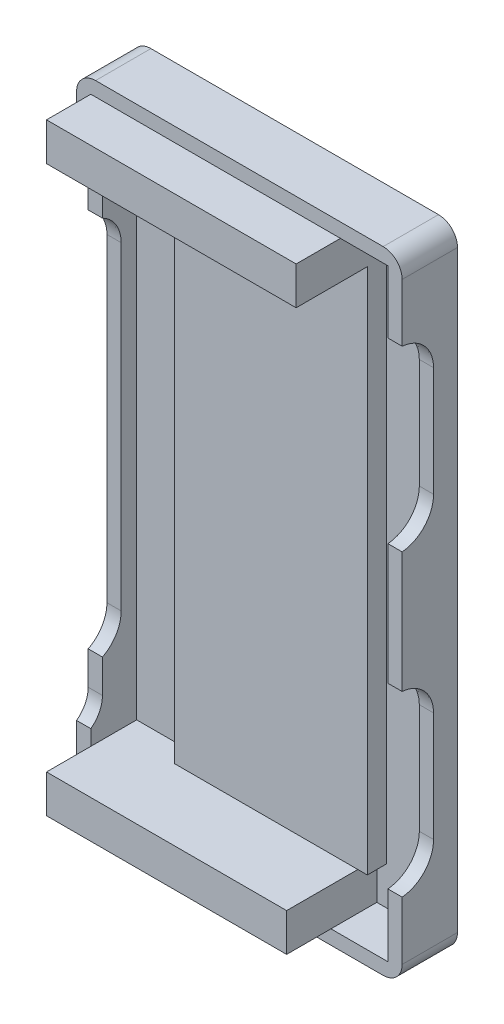
from build123d import *

# Parameters (mm, degrees)
BOSS_EXTRUDE3_DEPTH      = 3.249999
BOSS_EXTRUDE3_DEPTH_BACK = 16.581442
SKETCH1_W                = 34.3
SKETCH1_H                = 66.5
CUT_EXTRUDE1_DEPTH       = 5
CUT_EXTRUDE2_DEPTH       = 5
FILLET1_R                = 2
SKETCH5_W                = 51.30778099
SKETCH5_H                = 76.39990746
CUT_EXTRUDE3_DEPTH       = 14
SKETCH6_W                = 31.3
SKETCH6_H                = 63.5
CUT_EXTRUDE4_DEPTH       = 4.831437303
SKETCH7_W                = 26.3
SKETCH7_H                = 4
SKETCH7_W_2              = 25.3
BOSS_EXTRUDE4_DEPTH      = 9.5
SKETCH8_W                = 20.3
SKETCH8_H                = 55.5
BOSS_EXTRUDE5_DEPTH      = 2
CUT_EXTRUDE5_DEPTH       = 1.5


with BuildPart() as part:
    # Sketch1 → Boss-Extrude3 (new, two sides: drawn at the far end of the back side and taken through both)
    with BuildSketch(Plane.XY.offset(-BOSS_EXTRUDE3_DEPTH_BACK)):
        with Locations((-15.15, 31.25)):
            Rectangle(SKETCH1_W, SKETCH1_H)
    extrude(amount=BOSS_EXTRUDE3_DEPTH + BOSS_EXTRUDE3_DEPTH_BACK)

    # Sketch3 → Cut-Extrude1 (cut)
    with BuildSketch(Plane.ZY.offset(32.3)):
        with BuildLine():
            Line((-13.946442816, 47.860002379), (-13.946442816, 14.260002379))
            add(Edge.make_bspline(
                [(-13.946442816, 14.260002379), (-13.946442816, 14.019317473), (-13.90167089, 13.549905983), (-13.594210712, 12.544215416), (-12.741245974, 11.38215204), (-11.448721179, 10.74393594), (-10.404919412, 10.615783107), (-9.934864774, 10.653203818), (-9.697836412, 10.694998313)],
                knots=[0, 0, 0, 0, 0.125, 0.25, 0.5, 0.75, 0.875, 1, 1, 1, 1], degree=3))
            Line((-9.697836412, 10.694998313), (-6.707836413, 11.222215985))
            add(Edge.make_bspline(
                [(-6.707836413, 11.222215985), (-6.30796959, 11.292723295), (-5.54451734, 11.557407058), (-4.497780226, 12.405299319), (-3.844533346, 13.58336909), (-3.716442816, 14.381184638), (-3.716442816, 14.787220052)],
                knots=[0, 0, 0, 0, 0.25, 0.5, 0.75, 1, 1, 1, 1], degree=3))
            Line((-3.716442816, 14.787220052), (-3.716442816, 47.332784706))
            add(Edge.make_bspline(
                [(-3.716442816, 47.332784706), (-3.716442815, 47.73882012), (-3.844533346, 48.536635667), (-4.497780225, 49.714705439), (-5.544517339, 50.5625977), (-6.307969589, 50.827281463), (-6.707836412, 50.897788773)],
                knots=[0, 0, 0, 0, 0.25, 0.5, 0.75, 1, 1, 1, 1], degree=3))
            Line((-6.707836412, 50.897788773), (-9.697836412, 51.425006445))
            add(Edge.make_bspline(
                [(-9.697836412, 51.425006445), (-9.934864773, 51.46680094), (-10.404919411, 51.504221651), (-11.448721179, 51.376068818), (-12.741245974, 50.737852719), (-13.594210712, 49.575789343), (-13.90167089, 48.570098776), (-13.946442816, 48.100687285), (-13.946442816, 47.860002379)],
                knots=[0, 0, 0, 0, 0.125, 0.25, 0.5, 0.75, 0.875, 1, 1, 1, 1], degree=3))
        make_face()
    extrude(amount=-CUT_EXTRUDE1_DEPTH, mode=Mode.SUBTRACT)

    # Sketch4 → Cut-Extrude2 (cut)
    with BuildSketch(Plane(origin=(2, 0, 0), x_dir=(0, 0, -1), z_dir=(1, 0, 0))):
        with BuildLine():
            Line((6.817836087, 38.212213104), (9.807836086, 37.684995431))
            add(Edge.make_bspline(
                [(9.807836086, 37.684995431), (10.044864448, 37.643200936), (10.514919086, 37.605780225), (11.558720853, 37.733933058), (12.851245648, 38.372149158), (13.704210386, 39.534212534), (14.011670565, 40.539903101), (14.05644249, 41.009314591), (14.05644249, 41.249999497)],
                knots=[0, 0, 0, 0, 0.125, 0.25, 0.5, 0.75, 0.875, 1, 1, 1, 1], degree=3))
            Line((14.05644249, 41.249999497), (14.05644249, 52.799999497))
            add(Edge.make_bspline(
                [(14.05644249, 52.799999497), (14.05644249, 53.040684403), (14.011670565, 53.510095894), (13.704210386, 54.51578646), (12.851245648, 55.677849837), (11.558720853, 56.316065936), (10.514919086, 56.444218769), (10.044864448, 56.406798058), (9.807836087, 56.365003563)],
                knots=[0, 0, 0, 0, 0.125, 0.25, 0.5, 0.75, 0.875, 1, 1, 1, 1], degree=3))
            Line((9.807836087, 56.365003563), (6.817836087, 55.837785891))
            add(Edge.make_bspline(
                [(6.817836087, 55.837785891), (6.417969263, 55.767278581), (5.654517014, 55.502594818), (4.6077799, 54.654702557), (3.95453302, 53.476632786), (3.82644249, 52.678817239), (3.82644249, 52.272781825)],
                knots=[0, 0, 0, 0, 0.25, 0.5, 0.75, 1, 1, 1, 1], degree=3))
            Line((3.82644249, 52.272781825), (3.82644249, 41.77721717))
            add(Edge.make_bspline(
                [(3.82644249, 41.77721717), (3.82644249, 41.371181756), (3.95453302, 40.573366208), (4.6077799, 39.395296437), (5.654517014, 38.547404177), (6.417969263, 38.282720413), (6.817836087, 38.212213104)],
                knots=[0, 0, 0, 0, 0.25, 0.5, 0.75, 1, 1, 1, 1], degree=3))
        make_face()
        with BuildLine():
            Line((3.82644249, 20.772783732), (3.82644249, 10.277219077))
            add(Edge.make_bspline(
                [(3.82644249, 10.277219077), (3.82644249, 9.871183663), (3.95453302, 9.073368116), (4.6077799, 7.895298345), (5.654517014, 7.047406084), (6.417969263, 6.782722321), (6.817836087, 6.712215011)],
                knots=[0, 0, 0, 0, 0.25, 0.5, 0.75, 1, 1, 1, 1], degree=3))
            Line((6.817836087, 6.712215011), (9.807836086, 6.184997339))
            add(Edge.make_bspline(
                [(9.807836086, 6.184997339), (10.044864448, 6.143202843), (10.514919086, 6.105782132), (11.558720853, 6.233934965), (12.851245648, 6.872151065), (13.704210386, 8.034214441), (14.011670565, 9.039905008), (14.05644249, 9.509316499), (14.05644249, 9.750001404)],
                knots=[0, 0, 0, 0, 0.125, 0.25, 0.5, 0.75, 0.875, 1, 1, 1, 1], degree=3))
            Line((14.05644249, 9.750001404), (14.05644249, 21.300001404))
            add(Edge.make_bspline(
                [(14.05644249, 21.300001404), (14.05644249, 21.54068631), (14.011670565, 22.010097801), (13.704210386, 23.015788368), (12.851245648, 24.177851744), (11.558720853, 24.816067843), (10.514919086, 24.944220677), (10.044864448, 24.906799966), (9.807836087, 24.86500547)],
                knots=[0, 0, 0, 0, 0.125, 0.25, 0.5, 0.75, 0.875, 1, 1, 1, 1], degree=3))
            Line((9.807836087, 24.86500547), (6.817836087, 24.337787798))
            add(Edge.make_bspline(
                [(6.817836087, 24.337787798), (6.417969263, 24.267280488), (5.654517014, 24.002596725), (4.6077799, 23.154704464), (3.95453302, 21.976634693), (3.82644249, 21.178819146), (3.82644249, 20.772783732)],
                knots=[0, 0, 0, 0, 0.25, 0.5, 0.75, 1, 1, 1, 1], degree=3))
        make_face()
    extrude(amount=-CUT_EXTRUDE2_DEPTH, mode=Mode.SUBTRACT)

    # Fillet1
    fillet1_edges = [part.edges().sort_by_distance(p)[0] for p in [
        (-32.3, -2, -6.6657215),
        (2, -2, -6.6657215),
        (2, 64.5, -6.6657215),
        (-32.3, 64.5, -6.6657215),
    ]]
    fillet(fillet1_edges, radius=FILLET1_R)

    # Sketch5 → Cut-Extrude3 (cut)
    with BuildSketch(Plane(origin=(0, 2.84e-07, 3.250003097), x_dir=(1, 0, 0), z_dir=(0, 8.742273400000003e-08, 0.9999999999999963))):
        with Locations((-12.815688561, 29.564706803)):
            Rectangle(SKETCH5_W, SKETCH5_H)
    extrude(amount=-CUT_EXTRUDE3_DEPTH, mode=Mode.SUBTRACT)


with BuildPart() as cut_extrude3_kept_piece:
    # of the separate pieces the step leaves, the one the design keeps (cut_extrude3_pieces_kept)
    add(part.part.solids().sort_by_distance((-30.3, 64.5, -16.581442))[0])

    # Sketch6 → Cut-Extrude4 (cut)
    with BuildSketch(Plane(origin=(0, -9.4e-07, -10.749996903), x_dir=(1, 0, 0), z_dir=(0, 8.742273399652584e-08, 0.9999999999999963))):
        with Locations((-15.15, 31.25000094)):
            Rectangle(SKETCH6_W, SKETCH6_H)
    extrude(amount=-CUT_EXTRUDE4_DEPTH, mode=Mode.SUBTRACT)


with BuildPart() as boss_extrude4_tool:
    # Sketch7 → Boss-Extrude4 (new body)
    with BuildSketch(Plane(origin=(1.362e-06, 0, -15.581439757), x_dir=(0.9999999999999963, 0, 8.742273400000003e-08), z_dir=(-8.742273400000003e-08, 1.0000000000000005e-15, 0.9999999999999963))):
        with Locations((-17.650001362, 60.999999578)):
            Rectangle(SKETCH7_W, SKETCH7_H)
        with Locations((-18.150001362, 1.499999578)):
            Rectangle(SKETCH7_W_2, SKETCH7_H)
    extrude(amount=BOSS_EXTRUDE4_DEPTH)


with BuildPart() as cut_extrude3_kept_piece_1:
    add(cut_extrude3_kept_piece.part)


with BuildPart() as cut_extrude3_kept_piece_2:
    # Boss-Extrude4: joined with boss_extrude4_tool
    add(cut_extrude3_kept_piece_1.part.fuse(boss_extrude4_tool.part, tol=0.00001))

    # Sketch8 → Boss-Extrude5 (add)
    with BuildSketch(Plane(origin=(1.362e-06, 0, -15.581439757), x_dir=(0.9999999999999963, 0, 8.742273400000003e-08), z_dir=(-8.742273400000003e-08, 1.0000000000000005e-15, 0.9999999999999963))):
        with Locations((-14.650001362, 31.249999578)):
            Rectangle(SKETCH8_W, SKETCH8_H)
    extrude(amount=BOSS_EXTRUDE5_DEPTH)

    # Sketch9 → Cut-Extrude5 (cut)
    with BuildSketch(Plane.ZY.offset(32.3)):
        with BuildLine():
            Line((-11.974063023, 54.635108256), (-11.974063023, 7.533043045))
            ThreePointArc((-11.974063023, 7.533043045), (-8.974063023, 4.533043045), (-5.974063023, 7.533043045))
            Line((-5.974063023, 7.533043045), (-5.974063023, 54.635108256))
            ThreePointArc((-5.974063023, 54.635108256), (-8.974063023, 57.635108256), (-11.974063023, 54.635108256))
        make_face()
    extrude(amount=-CUT_EXTRUDE5_DEPTH, mode=Mode.SUBTRACT)


solid = cut_extrude3_kept_piece_2.part
